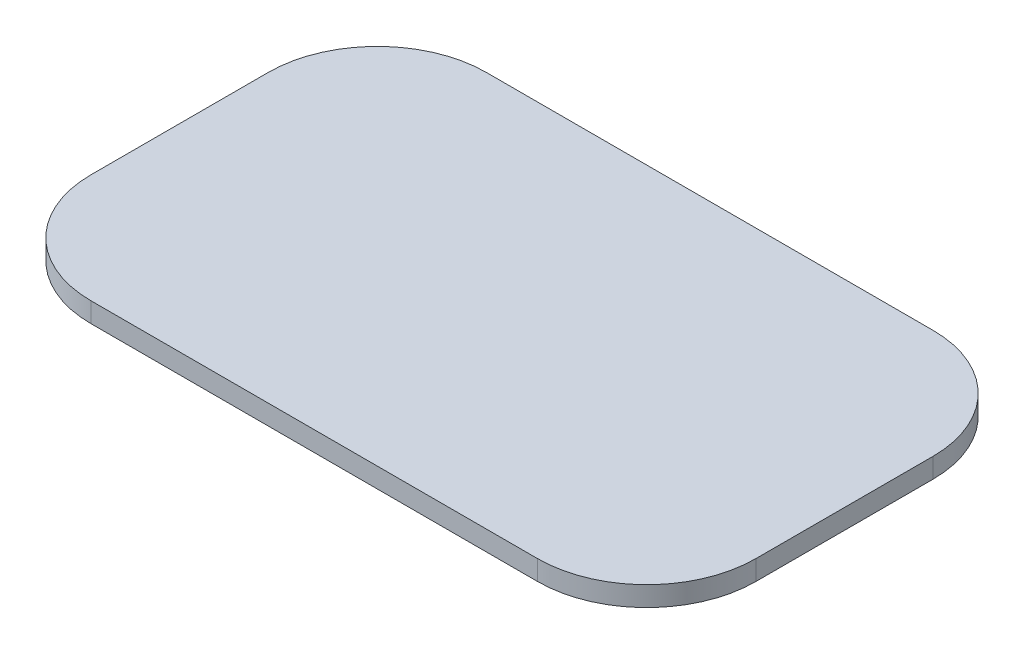
from build123d import *

# Parameters (mm, degrees)
BOSS_EXTRUDE1_DEPTH = 10
BOSS_EXTRUDE2_DEPTH = 10


with BuildPart() as part:
    # Sketch1 → Boss-Extrude1 (new body)
    with BuildSketch(Plane(origin=(0, 0, 0), x_dir=(1, 0, 0), z_dir=(0, 1, 0))):
        with BuildLine():
            Line((117.322501745, 42.275563128), (-19.177498255, 42.275563128))
            ThreePointArc((-19.177498255, 42.275563128), (-40.39070169, 33.488766564), (-49.177498255, 12.275563128))
            Line((-49.177498255, 12.275563128), (-49.177498255, -76.986202657))
            ThreePointArc((-49.177498255, -76.986202657), (-40.39070169, -98.199406092), (-19.177498255, -106.986202657))
            Line((-19.177498255, -106.986202657), (156.322501745, -106.986202657))
            Line((156.322501745, -106.986202657), (205.849333343, -106.986202657))
            ThreePointArc((205.849333343, -106.986202657), (227.062536779, -98.199406092), (235.849333343, -76.986202657))
            Line((235.849333343, -76.986202657), (235.849333343, -16.324436872))
            Line((235.849333343, -16.324436872), (147.322501745, -16.324436872))
            Line((147.322501745, -16.324436872), (147.322501745, 12.275563128))
            ThreePointArc((147.322501745, 12.275563128), (138.535705181, 33.488766564), (117.322501745, 42.275563128))
        make_face()
        Polygon((-30.855415411, -86.26815413), (-30.855415411, 17.73184587), (134.144584589, 17.73184587), (134.144584589, -34.26815413), (216.644584589, -34.26815413), (216.644584589, -86.26815413), (134.144584589, -86.26815413), align=None, mode=Mode.SUBTRACT)
    extrude(amount=BOSS_EXTRUDE1_DEPTH)

    # Sketch2 → Boss-Extrude2 (add)
    with BuildSketch(Plane(origin=(0, 10, 0), x_dir=(1, 0, 0), z_dir=(0, 1, 0))):
        with BuildLine():
            Line((117.322501745, 67.275563128), (205.849333343, 67.275563128))
            ThreePointArc((205.849333343, 67.275563128), (244.740206309, 51.166436093), (260.849333343, 12.275563128))
            Line((260.849333343, 12.275563128), (260.849333343, 8.675563128))
            Line((260.849333343, 8.675563128), (260.849333343, -76.986202657))
            ThreePointArc((260.849333343, -76.986202657), (244.740206309, -115.877075622), (205.849333343, -131.986202657))
            Line((205.849333343, -131.986202657), (-19.177498255, -131.986202657))
            ThreePointArc((-19.177498255, -131.986202657), (-58.06837122, -115.877075622), (-74.177498255, -76.986202657))
            Line((-74.177498255, -76.986202657), (-74.177498255, 12.275563128))
            ThreePointArc((-74.177498255, 12.275563128), (-58.06837122, 51.166436093), (-19.177498255, 67.275563128))
            Line((-19.177498255, 67.275563128), (117.322501745, 67.275563128))
        make_face()
    extrude(amount=BOSS_EXTRUDE2_DEPTH)


solid = part.part
